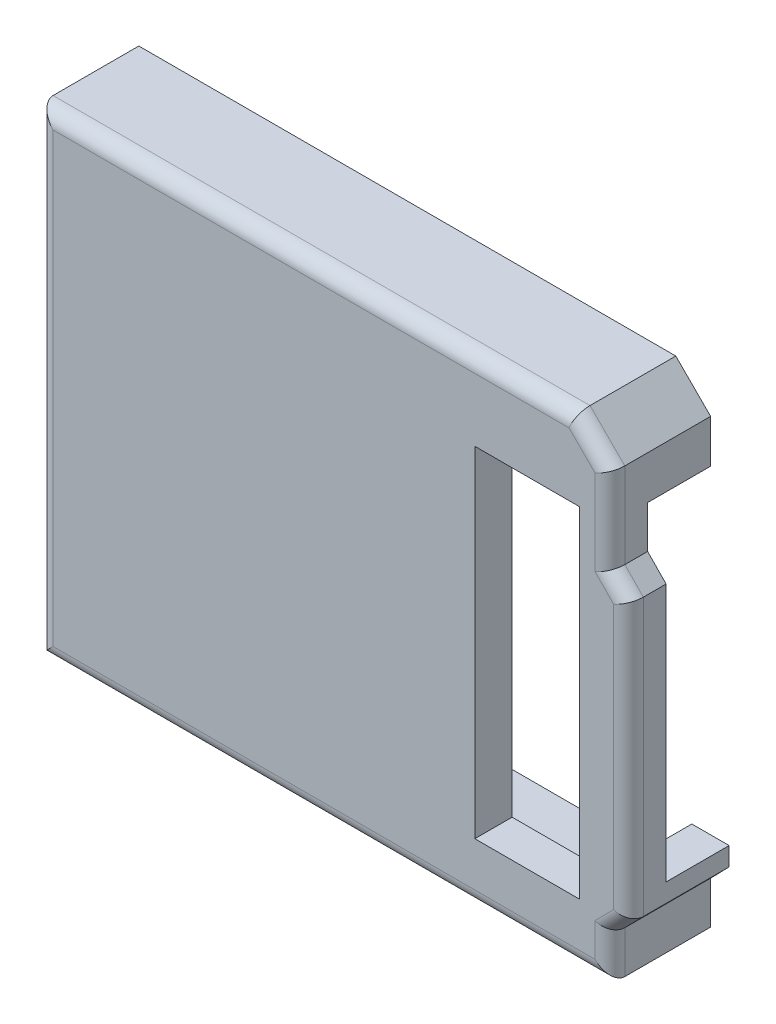
from build123d import *

# Parameters (mm, degrees)
BOSS_EXTRUDE1_DEPTH     = 13.5
CUT_EXTRUDE1_DEPTH      = 8.5
FILLET2_R               = 2
CUT_EXTRUDE2_DEPTH      = 19
CUT_EXTRUDE2_DEPTH_BACK = 40
SKETCH8_W               = 8.446671414
SKETCH8_H               = 42.807329121
CUT_EXTRUDE3_DEPTH      = 25


with BuildPart() as part:
    # Sketch4 → Boss-Extrude1 (new body)
    with BuildSketch(Plane.XY):
        Polygon((-58.781454962, -20.879462681), (17.888545038, -20.879462681), (17.888545038, -15.197779921), (20.368545038, -12.657779921), (20.368545038, 24.42485456), (17.888545038, 26.96485456), (17.888545038, 38.4295492), (13.219086919, 43.099007319), (-58.781454962, 43.099007319), align=None)
    extrude(amount=BOSS_EXTRUDE1_DEPTH)

    # Sketch6 → Cut-Extrude1 (cut)
    with BuildSketch(Plane(origin=(0, 0, 0), x_dir=(-1, 0, 0), z_dir=(0, 0, -1))):
        Polygon((53.781454962, -15.879462681), (53.781454962, 38.099007319), (-11.148019107, 38.099007319), (-12.888545038, 36.358481388), (-12.888545038, 24.92870622), (-15.368545038, 22.38870622), (-15.368545038, -10.621631581), (-12.888545038, -13.161631581), (-12.888545038, -15.879462681), align=None)
    extrude(amount=-CUT_EXTRUDE1_DEPTH, mode=Mode.SUBTRACT)

    # Fillet2
    fillet2_edges = [part.edges().sort_by_distance(p)[0] for p in [
        (19.128545038, 25.69485456, 13.5),
        (17.888545038, 32.69720188, 13.5),
        (15.553815978, 40.76427826, 13.5),
        (-22.781184022, 43.099007319, 13.5),
        (-58.781454962, 11.109772319, 13.5),
        (-20.446454962, -20.879462681, 13.5),
        (17.888545038, -18.038621301, 13.5),
        (19.128545038, -13.927779921, 13.5),
        (20.368545038, 5.883537319, 13.5),
    ]]
    fillet(fillet2_edges, radius=FILLET2_R)

    # Sketch8 → Cut-Extrude2 (cut, two sides: drawn at the far end of the back side and taken through both)
    with BuildSketch(Plane(origin=(20.368545038, 0, 0), x_dir=(0, 0, -1), z_dir=(1, 0, 0)).offset(-CUT_EXTRUDE2_DEPTH_BACK)):
        with Locations((-4.223335707, 11.23588464)):
            Rectangle(SKETCH8_W, SKETCH8_H)
    extrude(amount=CUT_EXTRUDE2_DEPTH + CUT_EXTRUDE2_DEPTH_BACK, mode=Mode.SUBTRACT)

    # Sketch9 → Cut-Extrude3 (cut)
    with BuildSketch(Plane.XY.offset(13.5)):
        Polygon((4.739463789, 32.6463636), (-0.228073878, 32.6463636), (-0.228073878, -12.92520431), (13.777293855, -12.92520431), (13.777293855, 32.6463636), align=None)
    extrude(amount=-CUT_EXTRUDE3_DEPTH, mode=Mode.SUBTRACT)


solid = part.part
